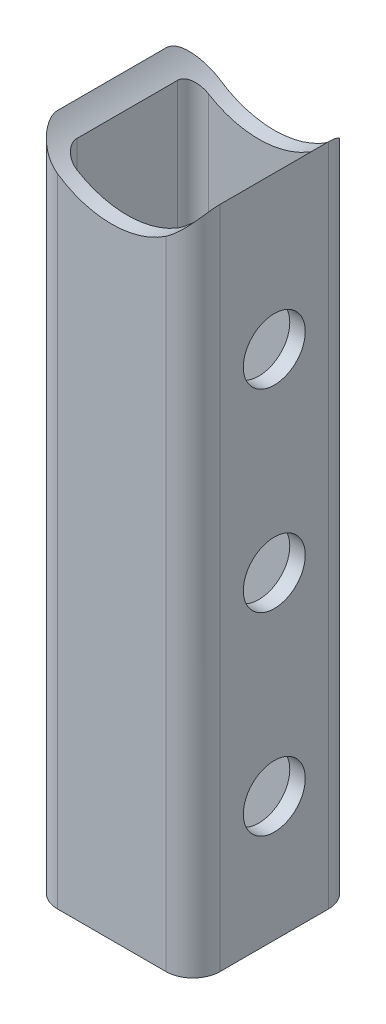
from build123d import *

# Parameters (mm, degrees)
EXTRUDE_1_DEPTH     = 110
SKETCH_2_R          = 12.5
CUT_EXTRUDE_1_DEPTH = 113.477775583
SKETCH_3_R          = 4
CUT_EXTRUDE_2_DEPTH = 109.293470631
SKETCH_4_W          = 32.835889631
SKETCH_4_H          = 20
CUT_EXTRUDE_4_DEPTH = 109.293470631


with BuildPart() as part:
    # Эскиз1 → Бобышка-Вытянуть1 (new body)
    with BuildSketch(Plane(origin=(0, 0, 0), x_dir=(1, 0, 0), z_dir=(0, 1, 0))):
        with BuildLine():
            Line((-6.992990841, -10.5), (6.992990841, -10.5))
            ThreePointArc((6.992990841, -10.5), (9.472820799, -9.472820799), (10.5, -6.992990841))
            Line((10.5, -6.992990841), (10.5, 6.992990841))
            ThreePointArc((10.5, 6.992990841), (9.472820799, 9.472820799), (6.992990841, 10.5))
            Line((6.992990841, 10.5), (-6.992990841, 10.5))
            ThreePointArc((-6.992990841, 10.5), (-9.472820799, 9.472820799), (-10.5, 6.992990841))
            Line((-10.5, 6.992990841), (-10.5, -6.992990841))
            ThreePointArc((-10.5, -6.992990841), (-9.472820799, -9.472820799), (-6.992990841, -10.5))
        make_face()
        with BuildLine():
            Line((6.5, 8.5), (-6.5, 8.5))
            ThreePointArc((-6.5, 8.5), (-7.914213562, 7.914213562), (-8.5, 6.5))
            Line((-8.5, 6.5), (-8.5, -6.5))
            ThreePointArc((-8.5, -6.5), (-7.914213562, -7.914213562), (-6.5, -8.5))
            Line((-6.5, -8.5), (6.5, -8.5))
            ThreePointArc((6.5, -8.5), (7.914213562, -7.914213562), (8.5, -6.5))
            Line((8.5, -6.5), (8.5, 6.5))
            ThreePointArc((8.5, 6.5), (7.914213562, 7.914213562), (6.5, 8.5))
        make_face(mode=Mode.SUBTRACT)
    extrude(amount=EXTRUDE_1_DEPTH)

    # Эскиз2 → Вырез-Вытянуть1 (cut, through all)
    with BuildSketch(Plane(origin=(0, 0, -10.5), x_dir=(-1, 0, 0), z_dir=(0, 0, -1))):
        with Locations((0, 112.5)):
            Circle(SKETCH_2_R)
    extrude(amount=-CUT_EXTRUDE_1_DEPTH, mode=Mode.SUBTRACT)

    # Эскиз3 → Вырез-Вытянуть2 (cut, through all)
    with BuildSketch(Plane(origin=(10.5, 0, 0), x_dir=(0, 0, -1), z_dir=(1, 0, 0))):
        with Locations((0, 36)):
            Circle(SKETCH_3_R)
        with Locations((0, 61)):
            Circle(SKETCH_3_R)
        with Locations((0, 86)):
            Circle(SKETCH_3_R)
    extrude(amount=-CUT_EXTRUDE_2_DEPTH, mode=Mode.SUBTRACT)

    # Эскиз4 → Вырез-Вытянуть4 (cut, through all)
    with BuildSketch(Plane.XY.offset(10.5)):
        with Locations((5.917944816, 9.891713851)):
            Rectangle(SKETCH_4_W, SKETCH_4_H)
    extrude(amount=-CUT_EXTRUDE_4_DEPTH, mode=Mode.SUBTRACT)


solid = part.part
